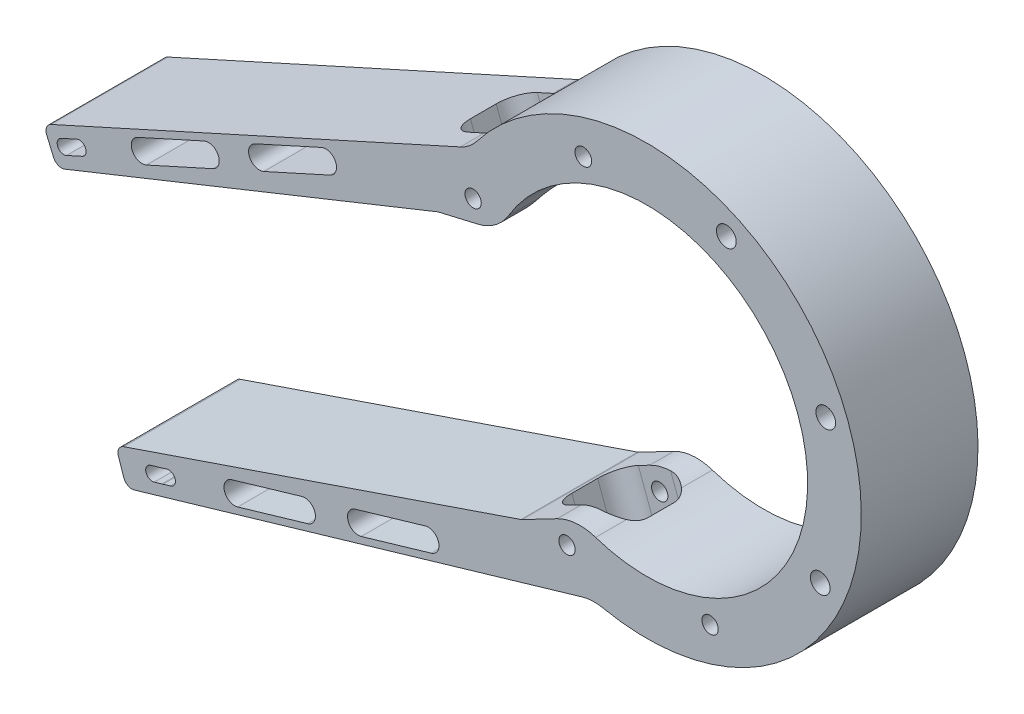
from build123d import *

# Parameters (mm, degrees)
SKETCH_1_R                = 1.55
SKETCH_1_R_2              = 1.6
EXTRUDE_1_DEPTH           = 27.2
SKETCH_2_R                = 1.6
EXTRUDE_2_DEPTH           = 27.2
SKETCH_3_R                = 1.95
SKETCH_3_R_2              = 1.9
SKETCH_3_R_3              = 1.6
CUT_EXTRUDE_1_DEPTH       = 69
SKETCH_5_R                = 1.55
CUT_EXTRUDE_2_DEPTH       = 47
EXTRUDE_3_DEPTH           = 27.2
SKETCH_7_R                = 1.7
CUT_EXTRUDE_4_DEPTH       = 27.2
SKETCH_8_W                = 23.2
SKETCH_8_H                = 1.314405841
SKETCH_8_H_2              = 6.430453101
CUT_EXTRUDE_6_DEPTH       = 31
FILLET_1_R                = 3
SKETCH_10_R               = 1.9
SKETCH_10_R_2             = 1.6
CUT_EXTRUDE_7_DEPTH       = 33
CUT_EXTRUDE_8_DEPTH       = 33
CUT_EXTRUDE_START         = -28
CUT_EXTRUDE_9_DEPTH       = 28
CUT_EXTRUDE_10_DEPTH      = 70
CUT_EXTRUDE_10_DEPTH_BACK = 57
SKETCH_12_R               = 2.3
SKETCH_12_R_2             = 1.9
CUT_EXTRUDE_11_DEPTH      = 55
CUT_EXTRUDE_12_DEPTH      = 29
FILLET_2_R                = 2


with BuildPart() as part:
    # 草图1 → 凸台-拉伸1 (new body)
    with BuildSketch(Plane.XY):
        with BuildLine():
            Line((-90.626902745, -8.531697933), (-3.752274841, 26.289161955))
            ThreePointArc((-3.752274841, 26.289161955), (-3.608897904, 26.340386512), (-3.462039704, 26.380555784))
            Line((-3.462039704, 26.380555784), (9.698688615, 29.44708148))
            ThreePointArc((9.698688615, 29.44708148), (10.502238558, 29.839612411), (11.054379031, 30.543113613))
            ThreePointArc((11.054379031, 30.543113613), (80.14468013, 27.607749368), (29.665517254, -19.656827057))
            ThreePointArc((29.665517254, -19.656827057), (28.788218412, -19.483276535), (27.922985813, -19.709430449))
            Line((27.922985813, -19.709430449), (15.943912263, -25.963241017))
            ThreePointArc((15.943912263, -25.963241017), (15.806360945, -26.0285138), (15.664242818, -26.083133752))
            Line((15.664242818, -26.083133752), (-72.913709428, -56.309606137))
            ThreePointArc((-72.913709428, -56.309606137), (-74.052071627, -57.298903756), (-74.175816282, -58.801989095))
            Line((-74.175816282, -58.801989095), (-72.950831199, -62.700371563))
            ThreePointArc((-72.950831199, -62.700371563), (-71.985052076, -63.864955408), (-70.480080128, -64.020017583))
            Line((-70.480080128, -64.020017583), (29.946523242, -34.573732039))
            ThreePointArc((29.946523242, -34.573732039), (32.359981773, -34.177747676), (34.797378916, -34.379442673))
            ThreePointArc((34.797378916, -34.379442673), (91.865127112, 31.952990735), (5.348593389, 45.052952513))
            ThreePointArc((5.348593389, 45.052952513), (3.631743465, 43.311110947), (1.543431134, 42.038107685))
            Line((1.543431134, 42.038107685), (-93.807696564, -1.098290442))
            ThreePointArc((-93.807696564, -1.098290442), (-94.847867325, -2.196939446), (-94.821068921, -3.709641231))
            Line((-94.821068921, -3.709641231), (-93.208721747, -7.464412982))
            ThreePointArc((-93.208721747, -7.464412982), (-92.135051341, -8.52356837), (-90.626902745, -8.531697933))
        make_face()
        with Locations((-89.008116262, -3.31726592)):
            Circle(SKETCH_1_R, mode=Mode.SUBTRACT)
        with Locations((-61.675025429, 9.048094791)):
            Circle(SKETCH_1_R, mode=Mode.SUBTRACT)
        with Locations((-34.341934596, 21.413455502)):
            Circle(SKETCH_1_R, mode=Mode.SUBTRACT)
        with Locations((4.541179636, 33.137631401)):
            Circle(SKETCH_1_R_2, mode=Mode.SUBTRACT)
        with Locations((29.514279916, 56.296816523)):
            Circle(SKETCH_1_R_2, mode=Mode.SUBTRACT)
        with Locations((63.548945318, 55.014184813)):
            Circle(SKETCH_1_R_2, mode=Mode.SUBTRACT)
        with Locations((86.70813044, 30.041084533)):
            Circle(SKETCH_1_R_2, mode=Mode.SUBTRACT)
        with Locations((85.42549873, -3.993580869)):
            Circle(SKETCH_1_R_2, mode=Mode.SUBTRACT)
        with Locations((60.45239845, -27.15276599)):
            Circle(SKETCH_1_R_2, mode=Mode.SUBTRACT)
        with Locations((26.417733048, -25.870134281)):
            Circle(SKETCH_1_R_2, mode=Mode.SUBTRACT)
        with Locations((-68.286961605, -59.208567241)):
            Circle(SKETCH_1_R, mode=Mode.SUBTRACT)
        with Locations((-39.498948939, -50.76757638)):
            Circle(SKETCH_1_R, mode=Mode.SUBTRACT)
        with Locations((-10.710936272, -42.326585519)):
            Circle(SKETCH_1_R, mode=Mode.SUBTRACT)
    extrude(amount=EXTRUDE_1_DEPTH)

    # 草图2 → 凸台-拉伸2 (add)
    with BuildSketch(Plane(origin=(0, 0, 0), x_dir=(-1, 0, 0), z_dir=(0, 0, -1))):
        with Locations((-29.514279916, 56.296816523)):
            Circle(SKETCH_2_R)
        with Locations((-60.45239845, -27.15276599)):
            Circle(SKETCH_2_R)
        with Locations((-26.417733048, -25.870134281)):
            Circle(SKETCH_2_R)
        with Locations((-85.42549873, -3.993580869)):
            Circle(SKETCH_2_R)
        with Locations((-4.541179636, 33.137631401)):
            Circle(SKETCH_2_R)
        with Locations((-63.548945318, 55.014184813)):
            Circle(SKETCH_2_R)
        with Locations((-86.70813044, 30.041084533)):
            Circle(SKETCH_2_R)
    extrude(amount=-EXTRUDE_2_DEPTH)

    # 草图3 → 切除-拉伸1 (cut)
    with BuildSketch(Plane(origin=(0, 0, 0), x_dir=(-1, 0, 0), z_dir=(0, 0, -1))):
        with Locations((-30.209518535, 54.421545006)):
            Circle(SKETCH_3_R)
        with Locations((-59.757159831, -25.277494473)):
            Circle(SKETCH_3_R_2)
        with Locations((-86.70813044, 30.041084533)):
            Circle(SKETCH_3_R_3)
        with Locations((-63.548945318, 55.014184813)):
            Circle(SKETCH_3_R_3)
        with Locations((-4.541179636, 33.137631401)):
            Circle(SKETCH_3_R_3)
        with Locations((-26.417733048, -25.870134281)):
            Circle(SKETCH_3_R_3)
        with Locations((-85.42549873, -3.993580869)):
            Circle(SKETCH_3_R_3)
    extrude(amount=-CUT_EXTRUDE_1_DEPTH, mode=Mode.SUBTRACT)

    # 草图5 → 切除-拉伸2 (cut)
    # profile 1 of 7: a face of its own
    with BuildSketch(Plane(origin=(0, 0, 0), x_dir=(-1, 0, 0), z_dir=(0, 0, -1))):
        with BuildLine():
            ThreePointArc((11.414352177, -39.927584463), (8.311935217, -41.623169614), (10.007520367, -44.725586574))
            Line((10.007520367, -44.725586574), (21.522725434, -48.101982919))
            ThreePointArc((21.522725434, -48.101982919), (24.625142394, -46.406397768), (22.929557244, -43.303980808))
            Line((22.929557244, -43.303980808), (11.414352177, -39.927584463))
        make_face()
        with Locations((10.710936272, -42.326585519)):
            Circle(SKETCH_5_R, mode=Mode.SUBTRACT)
    # profile 2 of 7: a face of its own
    with BuildSketch(Plane(origin=(0, 0, 0), x_dir=(-1, 0, 0), z_dir=(0, 0, -1))):
        with BuildLine():
            Line((51.71756991, -51.744971669), (40.202364844, -48.368575324))
            ThreePointArc((40.202364844, -48.368575324), (37.099947883, -50.064160475), (38.795533034, -53.166577435))
            Line((38.795533034, -53.166577435), (50.3107381, -56.54297378))
            ThreePointArc((50.3107381, -56.54297378), (53.413155061, -54.847388629), (51.71756991, -51.744971669))
        make_face()
        with Locations((39.498948939, -50.76757638)):
            Circle(SKETCH_5_R, mode=Mode.SUBTRACT)
    # profile 3 of 7: a face of its own
    with BuildSketch(Plane(origin=(0, 0, 0), x_dir=(-1, 0, 0), z_dir=(0, 0, -1))):
        with BuildLine():
            ThreePointArc((-33.081603993, -20.989171275), (-28.523177014, -20.430551715), (-24.109648008, -21.700226495))
            Line((-24.109648008, -21.700226495), (-27.922985813, -19.709430449))
            ThreePointArc((-27.922985813, -19.709430449), (-28.788218412, -19.483276535), (-29.665517254, -19.656827057))
            ThreePointArc((-29.665517254, -19.656827057), (-31.357266465, -20.364776853), (-33.081603993, -20.989171275))
        make_face()
    # profile 4 of 7: a face of its own
    with BuildSketch(Plane(origin=(0, 0, 0), x_dir=(-1, 0, 0), z_dir=(0, 0, -1))):
        with BuildLine():
            ThreePointArc((-5.509191146, 28.470904377), (-9.683741779, 30.385176437), (-12.776342155, 33.780339675))
            ThreePointArc((-12.776342155, 33.780339675), (-11.875770318, 32.182785721), (-11.054379031, 30.543113613))
            ThreePointArc((-11.054379031, 30.543113613), (-10.502238558, 29.839612411), (-9.698688615, 29.44708148))
            Line((-9.698688615, 29.44708148), (-5.509191146, 28.470904377))
        make_face()
    # profile 5 of 7: a face of its own
    with BuildSketch(Plane(origin=(0, 0, 0), x_dir=(-1, 0, 0), z_dir=(0, 0, -1))):
        with BuildLine():
            Line((70.64198304, -58.283832147), (68.723080996, -57.721187035))
            ThreePointArc((68.723080996, -57.721187035), (69.789098481, -59.590777661), (67.959157138, -60.72350758))
            Line((67.959157138, -60.72350758), (69.770755646, -61.255154549))
            ThreePointArc((69.770755646, -61.255154549), (71.692030544, -60.205107045), (70.64198304, -58.283832147))
        make_face()
    # profile 6 of 7: a face of its own
    with BuildSketch(Plane(origin=(0, 0, 0), x_dir=(-1, 0, 0), z_dir=(0, 0, -1))):
        with BuildLine():
            ThreePointArc((62.705472155, 11.32585236), (59.397267859, 10.078541517), (60.644578703, 6.770337221))
            Line((60.644578703, 6.770337221), (71.577815036, 1.824192937))
            ThreePointArc((71.577815036, 1.824192937), (74.886019331, 3.07150378), (73.638708488, 6.379708076))
            Line((73.638708488, 6.379708076), (62.705472155, 11.32585236))
        make_face()
        with Locations((61.675025429, 9.048094791)):
            Circle(SKETCH_5_R, mode=Mode.SUBTRACT)
    # profile 7 of 7: a face of its own
    with BuildSketch(Plane(origin=(0, 0, 0), x_dir=(-1, 0, 0), z_dir=(0, 0, -1))):
        with BuildLine():
            ThreePointArc((35.372381322, 23.691213072), (32.064177026, 22.443902228), (33.31148787, 19.135697933))
            Line((33.31148787, 19.135697933), (44.244724203, 14.189553648))
            ThreePointArc((44.244724203, 14.189553648), (47.552928498, 15.436864492), (46.305617655, 18.745068787))
            Line((46.305617655, 18.745068787), (35.372381322, 23.691213072))
        make_face()
        with Locations((34.341934596, 21.413455502)):
            Circle(SKETCH_5_R, mode=Mode.SUBTRACT)
    extrude(amount=-CUT_EXTRUDE_2_DEPTH, mode=Mode.SUBTRACT)

    # 草图6 → 凸台-拉伸3 (add)
    with BuildSketch(Plane(origin=(0, 0, 0), x_dir=(-1, 0, 0), z_dir=(0, 0, -1))):
        with BuildLine():
            ThreePointArc((72.950831199, -62.700371563), (71.985052076, -63.864955408), (70.480080128, -64.020017583))
            Line((70.480080128, -64.020017583), (106.974088631, -74.72049892))
            Line((106.974088631, -74.72049892), (108.783401826, -68.549833409))
            Line((108.783401826, -68.549833409), (72.913709428, -56.309606137))
            ThreePointArc((72.913709428, -56.309606137), (74.052071627, -57.298903756), (74.175816282, -58.801989095))
            Line((74.175816282, -58.801989095), (72.950831199, -62.700371563))
        make_face()
    extrude(amount=-EXTRUDE_3_DEPTH)

    # 草图7 → 切除-拉伸4 (cut)
    with BuildSketch(Plane(origin=(0, 0, 0), x_dir=(-1, 0, 0), z_dir=(0, 0, -1))):
        with Locations((98.878952825, -68.920572264)):
            Circle(SKETCH_7_R)
    extrude(amount=-CUT_EXTRUDE_4_DEPTH, mode=Mode.SUBTRACT)

    # 草图8 → 切除-拉伸6 (cut)
    with BuildSketch(Plane(origin=(-118.679748675, -34.798326843, 0), x_dir=(0, 0, 1), z_dir=(-0.9596004222168969, -0.28136636202850035, 0))):
        with Locations((11.6, -34.515256141)):
            Rectangle(SKETCH_8_W, SKETCH_8_H)
        with Locations((11.6, -38.387685612)):
            Rectangle(SKETCH_8_W, SKETCH_8_H_2)
    extrude(amount=-CUT_EXTRUDE_6_DEPTH, mode=Mode.SUBTRACT)

    # 圆角1
    fillet_1_edges = [part.edges().sort_by_distance(p)[0] for p in [
        (-78.316046934, -62.282156741, 23.2),
    ]]
    fillet(fillet_1_edges, radius=FILLET_1_R)

    # 草图10 → 切除-拉伸7 (cut)
    # profile 1 of 5: a face of its own
    with BuildSketch(Plane(origin=(0, 0, 0), x_dir=(-1, 0, 0), z_dir=(0, 0, -1))):
        with Locations((-86.70813044, 30.041084533)):
            Circle(SKETCH_10_R)
        with Locations((-86.70813044, 30.041084533)):
            Circle(SKETCH_10_R_2, mode=Mode.SUBTRACT)
    # profile 2 of 5: a face of its own
    with BuildSketch(Plane(origin=(0, 0, 0), x_dir=(-1, 0, 0), z_dir=(0, 0, -1))):
        with Locations((-85.42549873, -3.993580869)):
            Circle(SKETCH_10_R)
        with Locations((-85.42549873, -3.993580869)):
            Circle(SKETCH_10_R_2, mode=Mode.SUBTRACT)
    # profile 3 of 5: a face of its own
    with BuildSketch(Plane(origin=(0, 0, 0), x_dir=(-1, 0, 0), z_dir=(0, 0, -1))):
        with Locations((-26.417733048, -25.870134281)):
            Circle(SKETCH_10_R)
        with Locations((-26.417733048, -25.870134281)):
            Circle(SKETCH_10_R_2, mode=Mode.SUBTRACT)
    # profile 4 of 5: a face of its own
    with BuildSketch(Plane(origin=(0, 0, 0), x_dir=(-1, 0, 0), z_dir=(0, 0, -1))):
        with Locations((-4.541179636, 33.137631401)):
            Circle(SKETCH_10_R)
        with Locations((-4.541179636, 33.137631401)):
            Circle(SKETCH_10_R_2, mode=Mode.SUBTRACT)
    # profile 5 of 5: a face of its own
    with BuildSketch(Plane(origin=(0, 0, 0), x_dir=(-1, 0, 0), z_dir=(0, 0, -1))):
        with Locations((-63.548945318, 55.014184813)):
            Circle(SKETCH_10_R)
        with Locations((-63.548945318, 55.014184813)):
            Circle(SKETCH_10_R_2, mode=Mode.SUBTRACT)
    extrude(amount=-CUT_EXTRUDE_7_DEPTH, mode=Mode.SUBTRACT)

    # 草图5<6> → 切除-拉伸8 (cut)
    with BuildSketch(Plane(origin=(0, 0, 0), x_dir=(-1, 0, 0), z_dir=(0, 0, -1))):
        with BuildLine():
            Line((5.209518256, -43.318754764), (10.007520367, -44.725586574))
            ThreePointArc((10.007520367, -44.725586574), (8.311935217, -41.623169614), (11.414352177, -39.927584463))
            Line((11.414352177, -39.927584463), (6.616350066, -38.520752653))
            ThreePointArc((6.616350066, -38.520752653), (3.513933106, -40.216337804), (5.209518256, -43.318754764))
        make_face()
        with BuildLine():
            Line((40.202364844, -48.368575324), (35.404362733, -46.961743514))
            ThreePointArc((35.404362733, -46.961743514), (32.301945772, -48.657328665), (33.997530923, -51.759745625))
            Line((33.997530923, -51.759745625), (38.795533034, -53.166577435))
            ThreePointArc((38.795533034, -53.166577435), (37.099947883, -50.064160475), (40.202364844, -48.368575324))
        make_face()
        with BuildLine():
            ThreePointArc((66.992993054, -60.064137932), (66.795774604, -58.770500623), (67.656802005, -57.785094909))
            ThreePointArc((67.656802005, -57.785094909), (64.8796008, -58.21238333), (66.992993054, -60.064137932))
        make_face()
        with BuildLine():
            Line((56.089063564, 8.831230673), (60.644578703, 6.770337221))
            ThreePointArc((60.644578703, 6.770337221), (59.397267859, 10.078541517), (62.705472155, 11.32585236))
            Line((62.705472155, 11.32585236), (58.149957016, 13.386745812))
            ThreePointArc((58.149957016, 13.386745812), (54.84175272, 12.139434969), (56.089063564, 8.831230673))
        make_face()
        with BuildLine():
            Line((28.755972731, 21.196591385), (33.31148787, 19.135697933))
            ThreePointArc((33.31148787, 19.135697933), (32.064177026, 22.443902228), (35.372381322, 23.691213072))
            Line((35.372381322, 23.691213072), (30.816866183, 25.752106523))
            ThreePointArc((30.816866183, 25.752106523), (27.508661888, 24.50479568), (28.755972731, 21.196591385))
        make_face()
    extrude(amount=-CUT_EXTRUDE_8_DEPTH, mode=Mode.SUBTRACT)

    # 切除-拉伸9: read off the stored shape, not the designer's step
    # 切除-拉伸9 outline → 切除-拉伸9 (cut)
    with BuildSketch(Plane(origin=(0, 0, 0), x_dir=(-1, 0, 0), z_dir=(0, 0, -1)).offset(CUT_EXTRUDE_START)):
        with BuildLine():
            ThreePointArc((66.992993054, -60.064137932), (66.527286933, -60.187603435), (66.046167634, -60.162105554))
            Line((66.046167634, -60.162105554), (67.743388933, -60.660186424))
            ThreePointArc((67.743388933, -60.660186424), (67.321084334, -60.421467157), (66.992993054, -60.064137932))
        make_face()
        with BuildLine():
            Line((68.579445742, -57.679071454), (66.803878622, -57.158453862))
            ThreePointArc((66.803878622, -57.158453862), (67.285482524, -57.396720124), (67.656802005, -57.785094909))
            ThreePointArc((67.656802005, -57.785094909), (68.110016096, -57.661527192), (68.579445742, -57.679071454))
        make_face()
        with BuildLine():
            Line((89.542882565, -1.862437751), (87.93046684, -1.133447095))
            ThreePointArc((87.93046684, -1.133447095), (85.799067651, -1.800689117), (86.547033236, -3.905118233))
            Line((86.547033236, -3.905118233), (88.369239359, -4.729475643))
            ThreePointArc((88.369239359, -4.729475643), (87.573652487, -2.730057544), (89.542882565, -1.862437751))
        make_face()
        with BuildLine():
            ThreePointArc((89.747095245, -1.954764521), (90.396374365, -4.006642044), (88.369239359, -4.729475643))
            Line((88.369239359, -4.729475643), (90.1911631, -5.553705307))
            ThreePointArc((90.1911631, -5.553705307), (92.23987865, -4.781266578), (91.467439921, -2.732551028))
            Line((91.467439921, -2.732551028), (89.747095245, -1.954764521))
        make_face()
    cut_extrude_9 = extrude(amount=CUT_EXTRUDE_9_DEPTH, mode=Mode.SUBTRACT)

    # 镜向1: 切除-拉伸9 across plane
    add(cut_extrude_9.mirror(Plane(origin=(0.6861398, -1.850729216, 0), x_dir=(0, 0, 1), z_dir=(0.3476193093690684, -0.9376357585724705, 0))), mode=Mode.SUBTRACT)

    # 草图11 → 切除-拉伸10 (cut, two sides: drawn at the far end of the back side and taken through both)
    with BuildSketch(Plane(origin=(0.6861398, -1.850729216, 0), x_dir=(-0.9376357585724704, -0.3476193093690684, 0), z_dir=(0.3476193093690684, -0.9376357585724705, 0)).offset(-CUT_EXTRUDE_10_DEPTH_BACK)):
        with BuildLine():
            Line((-20.060434183, -5.6), (-12.060434183, -5.6))
            ThreePointArc((-12.060434183, -5.6), (-8.524900277, -7.064466094), (-7.060434183, -10.6))
            Line((-7.060434183, -10.6), (-7.060434183, -16.6))
            ThreePointArc((-7.060434183, -16.6), (-8.524900277, -20.135533906), (-12.060434183, -21.6))
            Line((-12.060434183, -21.6), (-20.060434183, -21.6))
            ThreePointArc((-20.060434183, -21.6), (-23.595968089, -20.135533906), (-25.060434183, -16.6))
            Line((-25.060434183, -16.6), (-25.060434183, -10.6))
            ThreePointArc((-25.060434183, -10.6), (-23.595968089, -7.064466094), (-20.060434183, -5.6))
        make_face()
    extrude(amount=CUT_EXTRUDE_10_DEPTH + CUT_EXTRUDE_10_DEPTH_BACK, mode=Mode.SUBTRACT)

    # 草图12 → 切除-拉伸11 (cut)
    # profile 1 of 3: a face of its own
    with BuildSketch(Plane(origin=(0, 0, 0), x_dir=(-1, 0, 0), z_dir=(0, 0, -1))):
        with Locations((-63.548945318, 55.014184813)):
            Circle(SKETCH_12_R)
        with Locations((-63.548945318, 55.014184813)):
            Circle(SKETCH_12_R_2, mode=Mode.SUBTRACT)
    # profile 2 of 3: a face of its own
    with BuildSketch(Plane(origin=(0, 0, 0), x_dir=(-1, 0, 0), z_dir=(0, 0, -1))):
        with Locations((-86.70813044, 30.041084533)):
            Circle(SKETCH_12_R)
        with Locations((-86.70813044, 30.041084533)):
            Circle(SKETCH_12_R_2, mode=Mode.SUBTRACT)
    # profile 3 of 3: a face of its own
    with BuildSketch(Plane(origin=(0, 0, 0), x_dir=(-1, 0, 0), z_dir=(0, 0, -1))):
        with Locations((-85.42549873, -3.993580869)):
            Circle(SKETCH_12_R)
        with Locations((-85.42549873, -3.993580869)):
            Circle(SKETCH_12_R_2, mode=Mode.SUBTRACT)
    extrude(amount=-CUT_EXTRUDE_11_DEPTH, mode=Mode.SUBTRACT)

    # 草图13 → 切除-拉伸12 (cut)
    with BuildSketch(Plane(origin=(0, 0, 0), x_dir=(-1, 0, 0), z_dir=(0, 0, -1))):
        Polygon((80.264611144, -58.81803879), (78.763613661, -58.305836173), (76.237620813, -65.708197621), (77.226475542, -65.998141697), (79.405618327, -58.566171786), align=None)
        Polygon((108.783401826, -68.549833409), (80.264611144, -58.81803879), (79.405618327, -58.566171786), (77.226475542, -65.998141697), (106.974088631, -74.72049892), align=None)
    extrude(amount=-CUT_EXTRUDE_12_DEPTH, mode=Mode.SUBTRACT)

    # 圆角2
    fillet_2_edges = [part.edges().sort_by_distance(p)[0] for p in [
        (-76.237620813, -65.708197621, 13.6),
        (-78.763613661, -58.305836173, 13.6),
    ]]
    fillet(fillet_2_edges, radius=FILLET_2_R)


solid = part.part
